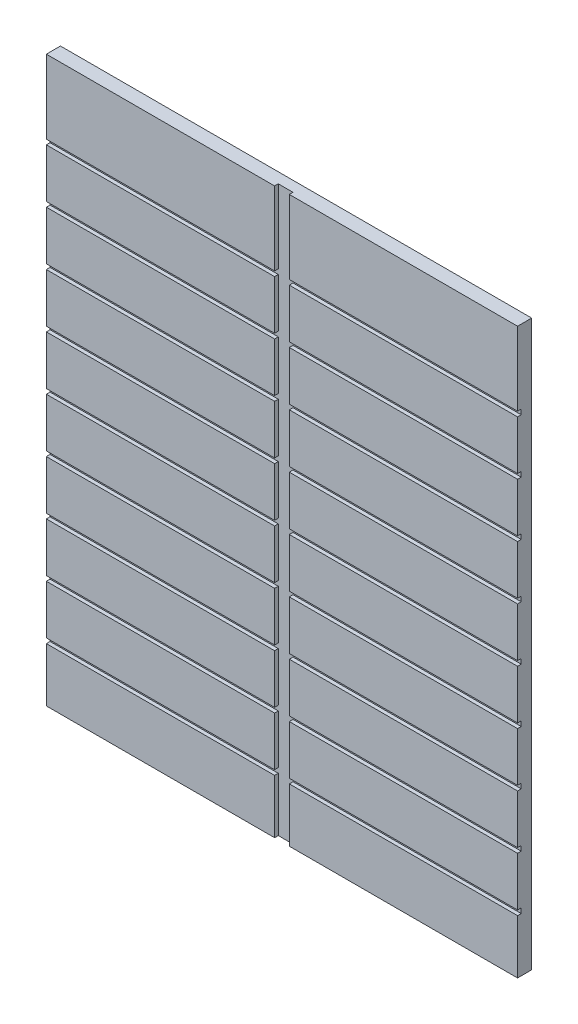
from build123d import *

# Parameters (mm, degrees)
PARTSCAB_REFERENCE_START = -1615.650675561
PARTSCAB_REFERENCE_DEPTH = 1475.316666667
SKETCH1_OUTSIDE_W        = 1806.569
SKETCH1_OUTSIDE_H        = 1061.502
SKETCH1_OUTSIDE_W_2      = 609.6
SKETCH1_OUTSIDE_H_2      = 730.25
CUT_EXTRUDE1_DEPTH       = 1820.964329577
SKETCH3_W                = 19.05
SKETCH3_H                = 4.7625
CUT_EXTRUDE3_DEPTH       = 1047.78093132
SKETCH4_W                = 609.6
SKETCH4_H                = 4.7625
BOSS_EXTRUDE1_DEPTH      = 730.25


# Read off the part's stored shape, not the designer's step: PartsCab_Reference
with BuildPart() as part:
    # PartsCab_Reference outline → PartsCab_Reference (new body)
    with BuildSketch(Plane.YZ.offset(PARTSCAB_REFERENCE_START)):
        Polygon((107.371492578, 9.178125), (107.371492578, -9.078125), (177.221492578, -9.078125), (177.221492578, -4.315625), (183.571492578, -4.315625), (183.571492578, -9.078125), (247.071492578, -9.078125), (247.071492578, -4.315625), (253.421492578, -4.315625), (253.421492578, -9.078125), (316.921492578, -9.078125), (316.921492578, -4.315625), (323.271492578, -4.315625), (323.271492578, -9.078125), (386.771492578, -9.078125), (386.771492578, -4.315625), (393.121492578, -4.315625), (393.121492578, -9.078125), (456.621492578, -9.078125), (456.621492578, -4.315625), (462.971492578, -4.315625), (462.971492578, -9.078125), (526.471492578, -9.078125), (526.471492578, -4.315625), (532.821492578, -4.315625), (532.821492578, -9.078125), (596.321492578, -9.078125), (596.321492578, -4.315625), (602.671492578, -4.315625), (602.671492578, -9.078125), (666.171492578, -9.078125), (666.171492578, -4.315625), (672.521492578, -4.315625), (672.521492578, -9.078125), (736.021492578, -9.078125), (736.021492578, -4.315625), (742.371492578, -4.315625), (742.371492578, -9.078125), (837.621492578, -9.078125), (837.621492578, 9.178125), (742.371492578, 9.178125), (742.371492578, 4.415625), (736.021492578, 4.415625), (736.021492578, 9.178125), (672.521492578, 9.178125), (672.521492578, 4.415625), (666.171492578, 4.415625), (666.171492578, 9.178125), (602.671492578, 9.178125), (602.671492578, 4.415625), (596.321492578, 4.415625), (596.321492578, 9.178125), (532.821492578, 9.178125), (532.821492578, 4.415625), (526.471492578, 4.415625), (526.471492578, 9.178125), (462.971492578, 9.178125), (462.971492578, 4.415625), (456.621492578, 4.415625), (456.621492578, 9.178125), (393.121492578, 9.178125), (393.121492578, 4.415625), (386.771492578, 4.415625), (386.771492578, 9.178125), (323.271492578, 9.178125), (323.271492578, 4.415625), (316.921492578, 4.415625), (316.921492578, 9.178125), (253.421492578, 9.178125), (253.421492578, 4.415625), (247.071492578, 4.415625), (247.071492578, 9.178125), (183.571492578, 9.178125), (183.571492578, 4.415625), (177.221492578, 4.415625), (177.221492578, 9.178125), align=None)
    extrude(amount=PARTSCAB_REFERENCE_DEPTH)

    # Sketch1 outside → Cut-Extrude1 (cut, through all)
    with BuildSketch(Plane.XY.offset(9.178125)):
        with Locations((-877.9925, 472.496)):
            Rectangle(SKETCH1_OUTSIDE_W, SKETCH1_OUTSIDE_H)
        with Locations((-445.134008894, 472.496492578)):
            Rectangle(SKETCH1_OUTSIDE_W_2, SKETCH1_OUTSIDE_H_2, mode=Mode.SUBTRACT)
    extrude(amount=-CUT_EXTRUDE1_DEPTH, mode=Mode.SUBTRACT)

    # Sketch3 → Cut-Extrude3 (cut, through all)
    with BuildSketch(Plane(origin=(0, 837.621492578, 0), x_dir=(1, 0, 0), z_dir=(0, 1, 0))):
        with Locations((-445.134008894, -6.796875)):
            Rectangle(SKETCH3_W, SKETCH3_H)
    extrude(amount=-CUT_EXTRUDE3_DEPTH, mode=Mode.SUBTRACT)

    # Sketch4 → Boss-Extrude1 (add)
    with BuildSketch(Plane(origin=(0, 837.621492578, 0), x_dir=(1, 0, 0), z_dir=(0, 1, 0))):
        with Locations((-445.134008894, 6.696875)):
            Rectangle(SKETCH4_W, SKETCH4_H)
    extrude(amount=-BOSS_EXTRUDE1_DEPTH)


solid = part.part
